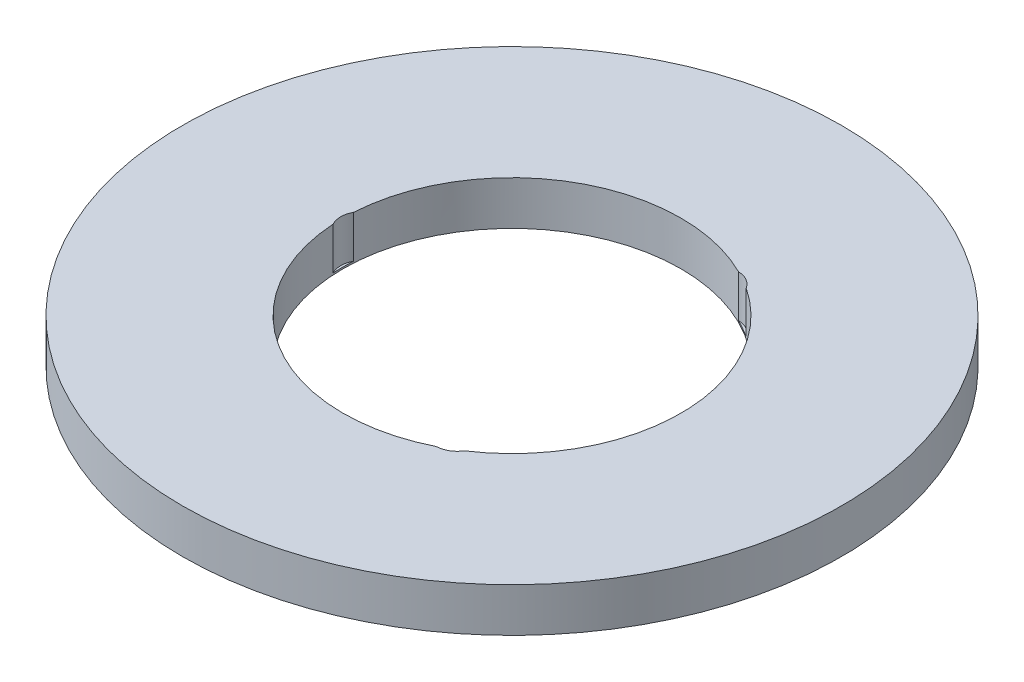
from build123d import *

# Parameters (mm, degrees)
SKETCH1_R           = 97.5
BOSS_EXTRUDE1_DEPTH = 13
SKETCH2_R           = 50
CUT_EXTRUDE1_DEPTH  = 139.497292392
SKETCH3_R           = 6.434173134
CUT_EXTRUDE2_DEPTH  = 12.527978801
CIRPATTERN1_COUNT   = 3


with BuildPart() as part:
    # Sketch1 → Boss-Extrude1 (new body)
    with BuildSketch(Plane(origin=(0, 0, 0), x_dir=(1, 0, 0), z_dir=(0, 1, 0))):
        Circle(SKETCH1_R)
    extrude(amount=BOSS_EXTRUDE1_DEPTH)

    # Sketch2 → Cut-Extrude1 (cut, through all)
    with BuildSketch(Plane(origin=(0, 0, 0), x_dir=(1, 0, 0), z_dir=(0, 1, 0))):
        Circle(SKETCH2_R)
    extrude(amount=CUT_EXTRUDE1_DEPTH, mode=Mode.SUBTRACT)

    # Sketch3 → Cut-Extrude2 (cut)
    with BuildSketch(Plane(origin=(0, 13, 0), x_dir=(1, 0, 0), z_dir=(0, 1, 0))):
        with Locations((-44.237188348, 0)):
            Circle(SKETCH3_R)
    cut_extrude2 = extrude(amount=-CUT_EXTRUDE2_DEPTH, mode=Mode.SUBTRACT)

    # CirPattern1: Cut-Extrude2 ×3 about axis
    cirpattern1_axis = Axis((0, 0, 0), (0, 1, 0))
    for i in range(1, CIRPATTERN1_COUNT):
        add(cut_extrude2.rotate(cirpattern1_axis, i * 360 / CIRPATTERN1_COUNT), mode=Mode.SUBTRACT)


solid = part.part
